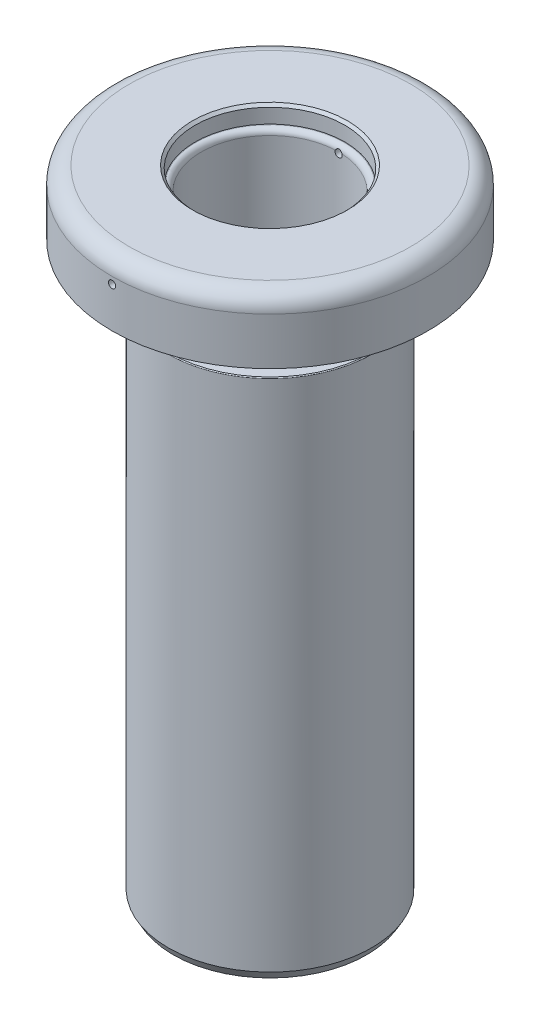
from build123d import *

# Parameters (mm, degrees)
CUT_EXTRUDE1_DEPTH      = 100.621118484
CUT_EXTRUDE1_DEPTH_BACK = 100.621118484
SKETCH2_R               = 0.5334
FILLET2_R               = 0.8128
FILLET3_R               = 2.54
CHAMFER1_SIZE           = 1.27
CHAMFER1_SIZE2          = 0.733234842
FILLET5_R               = 0.254
FILLET6_R               = 0.127
FILLET7_R               = 0.254


with BuildPart() as part:
    # Sketch1 → Revolve1 (revolve)
    with BuildSketch(Plane.XY, mode=Mode.PRIVATE) as revolve1_sk:
        Polygon((-11.0744, -0.381), (-11.0744, -2.54), (-10.16, -2.54), (-10.16, -93.98), (-15.0495, -93.98), (-15.0495, -16.5608), (-13.0175, -16.5608), (-13.0175, -12.954), (-15.0495, -12.954), (-15.0495, -9.525), (-17.3736, -9.525), (-17.3736, -7.5692), (-20.9042, -7.5692), (-20.9042, -9.525), (-23.368, -9.525), (-23.368, 0), (-11.4554, 0), align=None)
    revolve(revolve1_sk.sketch.rotate(Axis((0, 0, 0), (0, 1, 0)), 270), axis=Axis((0, 0, 0), (0, 1, 0)))

    # Sketch2 → Cut-Extrude1 (cut, two sides: drawn at the far end of the back side and taken through both)
    with BuildSketch(Plane.XY.offset(-CUT_EXTRUDE1_DEPTH_BACK)):
        with Locations((0, -3.556)):
            Circle(SKETCH2_R)
    extrude(amount=CUT_EXTRUDE1_DEPTH + CUT_EXTRUDE1_DEPTH_BACK, mode=Mode.SUBTRACT)

    # Fillet2
    # the kernel refuses this fillet: 0.8128 mm, written as the material it takes off along each edge
    with BuildSketch(Plane(origin=(0, -2.54, 0), x_dir=(0, 0, -1), z_dir=(1, 0, 0))) as fillet2_piece_1:
        with BuildLine():
            CenterArc((10.16 + FILLET2_R, -FILLET2_R), FILLET2_R, 90, 90)
            Line((10.16, -FILLET2_R), (10.16, 0))
            Line((10.16, 0), (10.16 + FILLET2_R, 0))
        make_face()
    revolve(axis=Axis((0, -2.54, 0), (0, 1, 0)), mode=Mode.SUBTRACT)

    # Fillet3
    fillet3_edges = [part.edges().sort_by_distance(p)[0] for p in [
        (0, 0, 23.368),
    ]]
    fillet(fillet3_edges, radius=FILLET3_R)

    # Chamfer1
    chamfer1_edges = [part.edges().sort_by_distance(p)[0] for p in [
        (0, -93.98, 15.0495),
    ]]
    chamfer1_side = [part.faces().sort_by_distance(p)[0] for p in [
        (0, -55.2704, 15.0495),
    ]]
    chamfer(chamfer1_edges, length=CHAMFER1_SIZE, length2=CHAMFER1_SIZE2, reference=chamfer1_side[0])

    # Fillet5
    fillet5_edges = [part.edges().sort_by_distance(p)[0] for p in [
        (0, -12.954, 13.0175),
        (0, -16.5608, 13.0175),
    ]]
    fillet(fillet5_edges, radius=FILLET5_R)

    # Fillet6
    fillet6_edges = [part.edges().sort_by_distance(p)[0] for p in [
        (0, -9.525, 20.9042),
        (0, -9.525, 17.3736),
        (0, -12.954, 15.0495),
        (0, -16.5608, 15.0495),
    ]]
    fillet(fillet6_edges, radius=FILLET6_R)

    # Fillet7
    fillet7_edges = [part.edges().sort_by_distance(p)[0] for p in [
        (0, -7.5692, 20.9042),
        (0, -7.5692, 17.3736),
    ]]
    fillet(fillet7_edges, radius=FILLET7_R)


solid = part.part
